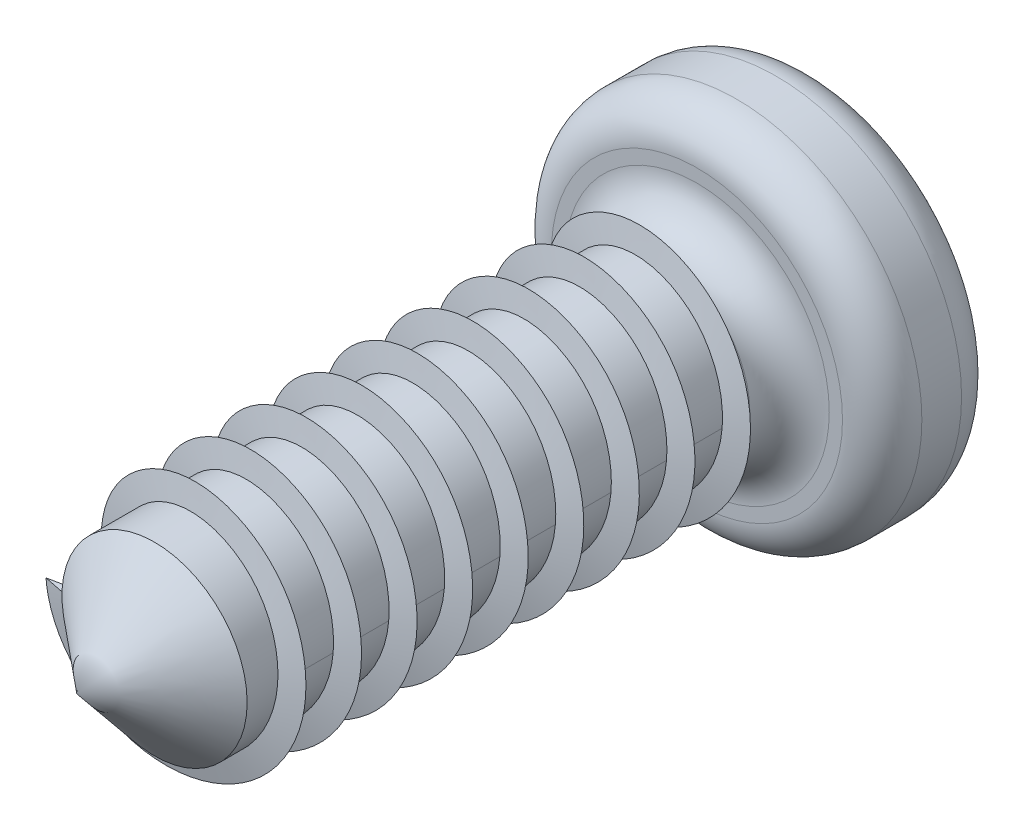
from build123d import *

# Parameters (mm, degrees)
SKETCH1_R           = 1.4
BOSS_EXTRUDE1_DEPTH = 5
CUT_EXTRUDE1_START  = -4.1
SKETCH2_R           = 1.4
SKETCH2_R_2         = 0.7
CUT_EXTRUDE1_DEPTH  = 4.1
SKETCH3_R           = 0.7
BOSS_EXTRUDE2_DEPTH = 0.6
BOSS_EXTRUDE2_TAPER = 50
FILLET1_R           = 0.3
FILLET2_R           = 0.3
CUT_EXTRUDE2_DEPTH  = 0.6
SWEEP1_PITCH        = 0.42


with BuildPart() as part:
    # Sketch1 → Boss-Extrude1 (new body)
    with BuildSketch(Plane.XY):
        Circle(SKETCH1_R)
    extrude(amount=BOSS_EXTRUDE1_DEPTH)

    # Sketch2 → Cut-Extrude1 (cut)
    with BuildSketch(Plane.XY.offset(5).offset(CUT_EXTRUDE1_START)):
        Circle(SKETCH2_R)
        Circle(SKETCH2_R_2, mode=Mode.SUBTRACT)
    extrude(amount=CUT_EXTRUDE1_DEPTH, mode=Mode.SUBTRACT)

    # Sketch3 → Boss-Extrude2 (add)
    with BuildSketch(Plane.XY.offset(5)):
        Circle(SKETCH3_R)
    extrude(amount=BOSS_EXTRUDE2_DEPTH, taper=BOSS_EXTRUDE2_TAPER)

    # Fillet1
    fillet1_edges = [part.edges().sort_by_distance(p)[0] for p in [
        (-1.4, 0, 0),
        (-1.4, 0, 0.9),
    ]]
    fillet(fillet1_edges, radius=FILLET1_R)

    # Fillet2
    fillet2_edges = [part.edges().sort_by_distance(p)[0] for p in [
        (-0.7, 0, 0.9),
    ]]
    fillet(fillet2_edges, radius=FILLET2_R)

    # Sketch4 → Cut-Extrude2 (cut)
    with BuildSketch(Plane(origin=(0, 0, 0), x_dir=(-1, 0, 0), z_dir=(0, 0, -1))):
        Polygon((-0.15, -0.15), (-0.15, -0.9), (0.15, -0.9), (0.15, -0.15), (0.9, -0.15), (0.9, 0.15), (0.15, 0.15), (0.15, 0.9), (-0.15, 0.9), (-0.15, 0.15), (-0.9, 0.15), (-0.9, -0.15), align=None)
    extrude(amount=-CUT_EXTRUDE2_DEPTH, mode=Mode.SUBTRACT)

    # Sweep1: the profile of Sketch6 profile screwed along a left-hand helix of 9 turns, 6 arcs to a turn; built about Z, then put on its axis
    sweep1_z = Axis((0, 0, 0), (0, 0, 1))
    sweep1_corners = [(0.6997, 0, 6.1018e-05), (0.6997, 0, -0.071766728), (0.876274823, 0, -0.035852855)]
    with BuildLine(mode=Mode.PRIVATE) as sweep1_profile:
        Line(sweep1_corners[0], sweep1_corners[1])
        Line(sweep1_corners[1], sweep1_corners[2])
        Line(sweep1_corners[2], sweep1_corners[0])
    sweep1_cap = Face(sweep1_profile.wire())
    sweep1_turn_angles = [0, -30, -60, -90, -120, -150, -180, -210, -240, -270, -300, -330, -360]
    sweep1_turn_weights = [1, 0.8660254037844387, 1, 0.8660254037844387, 1, 0.8660254037844387, 1, 0.8660254037844387, 1, 0.8660254037844387, 1, 0.8660254037844387, 1]
    sweep1_turn_rails = [Edge.make_bspline([Vector(p[0], p[1], 0).rotate(sweep1_z, sweep1_turn_angles[k]) / sweep1_turn_weights[k] + Vector(0, 0, p[2] + -SWEEP1_PITCH * sweep1_turn_angles[k] / 360) for k in range(13)], [0, 0, 0, 1, 1, 2, 2, 3, 3, 4, 4, 5, 5, 6, 6, 6], 2, sweep1_turn_weights) for p in sweep1_corners]
    sweep1_turn_sides = [Face.make_surface_from_curves(sweep1_turn_rails[p[0]], sweep1_turn_rails[p[1]]) for p in [(0, 1), (1, 2), (2, 0)]]
    sweep1 = Plane(origin=(0, 0, 1.2), x_dir=(-1, 0, 0), z_dir=(0, 0, 1)) * Solid(Shell([*[p.moved(Location((0, 0, SWEEP1_PITCH * i))) for i in range(9) for p in sweep1_turn_sides], sweep1_cap, sweep1_cap.rotate(sweep1_z, -3240).moved(Location((0, 0, -SWEEP1_PITCH * -3240 / 360)))]))
    add(sweep1)


solid = part.part
